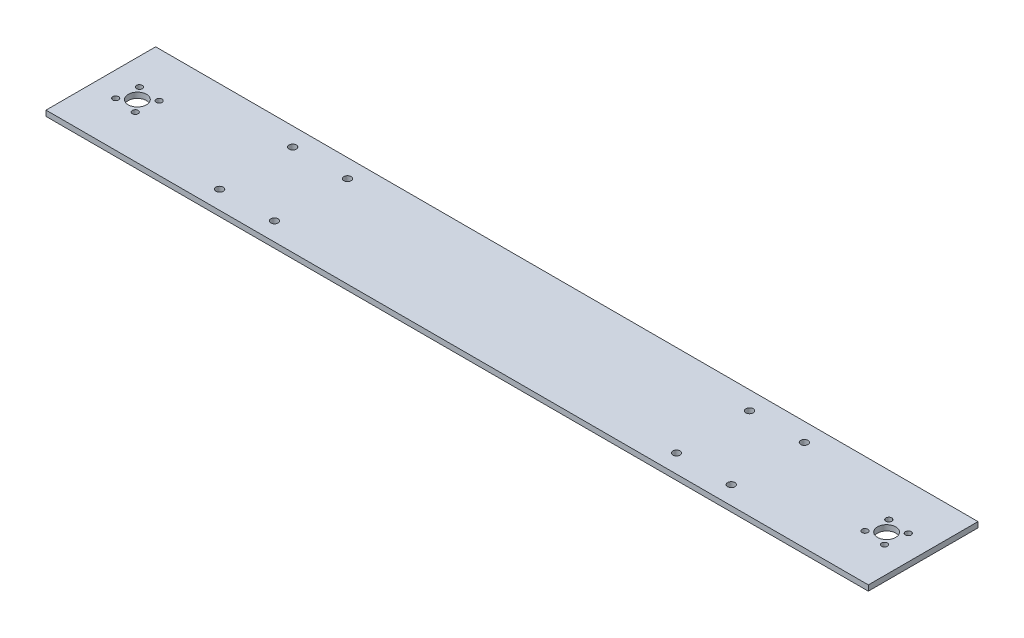
from build123d import *

# Parameters (mm, degrees)
SZKIC1_W                    = 450
SZKIC1_H                    = 60
DODANIE_WYCI_GNI_CIE1_DEPTH = 3
OTW_R_POD_RUB_M41_D         = 4
SZKIC8_R                    = 5
WYTNIJ_WYCI_GNI_CIE1_DEPTH  = 10
SZKIC9_R                    = 1.6
WYTNIJ_WYCI_GNI_CIE2_DEPTH  = 454.992290683
SZKIC10_R                   = 1.6
WYTNIJ_WYCI_GNI_CIE3_DEPTH  = 10


with BuildPart() as part:
    # Szkic1 → Dodanie-wyciągnięcie1 (new body)
    with BuildSketch(Plane(origin=(0, 0, 0), x_dir=(1, 0, 0), z_dir=(0, 1, 0))):
        with Locations((-225, 30)):
            Rectangle(SZKIC1_W, SZKIC1_H)
    extrude(amount=DODANIE_WYCI_GNI_CIE1_DEPTH)

    # Otwór pod śrubę M41 (through all)
    with Locations(Plane(origin=(0, 3, 0), x_dir=(1, 0, 0), z_dir=(0, 1, 0))):
        with Locations((-365, 50), (-335, 50), (-365, 10), (-335, 10), (-115, 50), (-85, 50), (-115, 10), (-85, 10)):
            Hole(OTW_R_POD_RUB_M41_D / 2)

    # Szkic8 → Wytnij-wyciągnięcie1 (cut)
    with BuildSketch(Plane(origin=(0, 3, 0), x_dir=(1, 0, 0), z_dir=(0, 1, 0))):
        with Locations((-20, 30)):
            Circle(SZKIC8_R)
        with Locations((-430, 30)):
            Circle(SZKIC8_R)
    extrude(amount=-WYTNIJ_WYCI_GNI_CIE1_DEPTH, mode=Mode.SUBTRACT)

    # Szkic9 → Wytnij-wyciągnięcie2 (cut, through all)
    with BuildSketch(Plane(origin=(0, 3, 0), x_dir=(1, 0, 0), z_dir=(0, 1, 0))):
        with Locations((-435.356336542, 36.510917908)):
            Circle(SZKIC9_R)
        with Locations((-436.510917908, 24.643663458)):
            Circle(SZKIC9_R)
        with Locations((-424.643663458, 23.489082092)):
            Circle(SZKIC9_R)
        with Locations((-423.489082092, 35.356336542)):
            Circle(SZKIC9_R)
    extrude(amount=-WYTNIJ_WYCI_GNI_CIE2_DEPTH, mode=Mode.SUBTRACT)

    # Szkic10 → Wytnij-wyciągnięcie3 (cut)
    with BuildSketch(Plane(origin=(0, 3, 0), x_dir=(1, 0, 0), z_dir=(0, 1, 0))):
        with Locations((-13.489082092, 35.356336542)):
            Circle(SZKIC10_R)
        with Locations((-14.643663458, 23.489082092)):
            Circle(SZKIC10_R)
        with Locations((-26.510917908, 24.643663458)):
            Circle(SZKIC10_R)
        with Locations((-25.345722644, 36.554977749)):
            Circle(SZKIC10_R)
    extrude(amount=-WYTNIJ_WYCI_GNI_CIE3_DEPTH, mode=Mode.SUBTRACT)


solid = part.part
